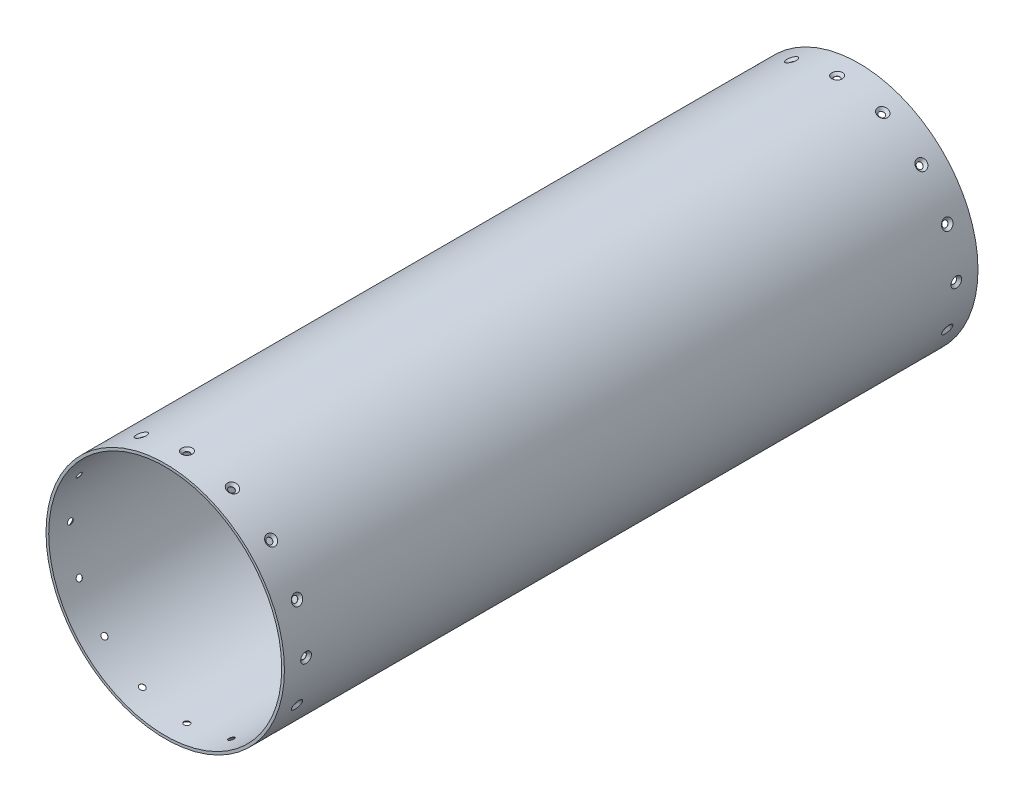
from build123d import *

# Parameters (mm, degrees)
SKETCH1_R                                       = 69.85
SKETCH1_R_2                                     = 68.2625
EXTRUDE1_DEPTH                                  = 406.4
CSK_FOR_M3_FLAT_HEAD_MACHINE_SCREW1_D           = 3.4
CSK_FOR_M3_FLAT_HEAD_MACHINE_SCREW1_CSINK_D     = 6.3
CSK_FOR_M3_FLAT_HEAD_MACHINE_SCREW1_CSINK_ANGLE = 90
CIRPATTERN1_COUNT                               = 16
LPATTERN1_COPY_1_D                              = 3.4
LPATTERN1_COPY_1_CSINK_D                        = 6.3
LPATTERN1_COPY_1_CSINK_ANGLE                    = 90
LPATTERN1_COPY_2_D                              = 3.4
LPATTERN1_COPY_2_CSINK_D                        = 6.3
LPATTERN1_COPY_2_CSINK_ANGLE                    = 90
LPATTERN1_COPY_3_D                              = 3.4
LPATTERN1_COPY_3_CSINK_D                        = 6.3
LPATTERN1_COPY_3_CSINK_ANGLE                    = 90
LPATTERN1_COPY_4_D                              = 3.4
LPATTERN1_COPY_4_CSINK_D                        = 6.3
LPATTERN1_COPY_4_CSINK_ANGLE                    = 90
LPATTERN1_COPY_5_D                              = 3.4
LPATTERN1_COPY_5_CSINK_D                        = 6.3
LPATTERN1_COPY_5_CSINK_ANGLE                    = 90
LPATTERN1_COPY_6_D                              = 3.4
LPATTERN1_COPY_6_CSINK_D                        = 6.3
LPATTERN1_COPY_6_CSINK_ANGLE                    = 90
LPATTERN1_COPY_7_D                              = 3.4
LPATTERN1_COPY_7_CSINK_D                        = 6.3
LPATTERN1_COPY_7_CSINK_ANGLE                    = 90
LPATTERN1_COPY_8_D                              = 3.4
LPATTERN1_COPY_8_CSINK_D                        = 6.3
LPATTERN1_COPY_8_CSINK_ANGLE                    = 90
LPATTERN1_COPY_9_D                              = 3.4
LPATTERN1_COPY_9_CSINK_D                        = 6.3
LPATTERN1_COPY_9_CSINK_ANGLE                    = 90
LPATTERN1_COPY_10_D                             = 3.4
LPATTERN1_COPY_10_CSINK_D                       = 6.3
LPATTERN1_COPY_10_CSINK_ANGLE                   = 90
LPATTERN1_COPY_11_D                             = 3.4
LPATTERN1_COPY_11_CSINK_D                       = 6.3
LPATTERN1_COPY_11_CSINK_ANGLE                   = 90
LPATTERN1_COPY_12_D                             = 3.4
LPATTERN1_COPY_12_CSINK_D                       = 6.3
LPATTERN1_COPY_12_CSINK_ANGLE                   = 90
LPATTERN1_COPY_13_D                             = 3.4
LPATTERN1_COPY_13_CSINK_D                       = 6.3
LPATTERN1_COPY_13_CSINK_ANGLE                   = 90
LPATTERN1_COPY_14_D                             = 3.4
LPATTERN1_COPY_14_CSINK_D                       = 6.3
LPATTERN1_COPY_14_CSINK_ANGLE                   = 90
LPATTERN1_COPY_15_D                             = 3.4
LPATTERN1_COPY_15_CSINK_D                       = 6.3
LPATTERN1_COPY_15_CSINK_ANGLE                   = 90
LPATTERN1_COPY_16_D                             = 3.4
LPATTERN1_COPY_16_CSINK_D                       = 6.3
LPATTERN1_COPY_16_CSINK_ANGLE                   = 90
F_10_CLEARANCE_HOLE4_D                          = 5.1054
F_10_CLEARANCE_HOLE4_DEPTH                      = 12.7
F_10_CLEARANCE_HOLE4_TIP                        = 1.533816902


with BuildPart() as part:
    # Sketch1 → Extrude1 (new body)
    with BuildSketch(Plane.XY):
        Circle(SKETCH1_R)
        Circle(SKETCH1_R_2, mode=Mode.SUBTRACT)
    extrude(amount=EXTRUDE1_DEPTH)

    # CSK for M3 Flat Head Machine Screw1 (through all)
    with Locations(Plane(origin=(0, -69.85, 12.7), x_dir=(1, 0, 0), z_dir=(0, -1, 0))):
        with Locations((0, 0)):
            csk_for_m3_flat_head_machine_screw1 = CounterSinkHole(CSK_FOR_M3_FLAT_HEAD_MACHINE_SCREW1_D / 2, CSK_FOR_M3_FLAT_HEAD_MACHINE_SCREW1_CSINK_D / 2, counter_sink_angle=CSK_FOR_M3_FLAT_HEAD_MACHINE_SCREW1_CSINK_ANGLE)

    # CirPattern1: CSK for M3 Flat Head Machine Screw1 ×16 about axis
    cirpattern1_axis = Axis((0, 0, 406.4), (0, 0, -1))
    for i in range(1, CIRPATTERN1_COUNT):
        add(csk_for_m3_flat_head_machine_screw1.rotate(cirpattern1_axis, i * 360 / CIRPATTERN1_COUNT), mode=Mode.SUBTRACT)

    # LPattern1 copy 1 (through all)
    with Locations(Plane(origin=(-26.730437751, -64.532985346, 393.7), x_dir=(0.9238795325112867, -0.3826834323650898, 0), z_dir=(-0.3826834323650898, -0.9238795325112867, 0))):
        with Locations((0, 0)):
            CounterSinkHole(LPATTERN1_COPY_1_D / 2, LPATTERN1_COPY_1_CSINK_D / 2, counter_sink_angle=LPATTERN1_COPY_1_CSINK_ANGLE)

    # LPattern1 copy 2 (through all)
    with Locations(Plane(origin=(-49.391408666, -49.391408666, 393.7), x_dir=(0.7071067811865476, -0.7071067811865475, 0), z_dir=(-0.7071067811865475, -0.7071067811865476, 0))):
        with Locations((0, 0)):
            CounterSinkHole(LPATTERN1_COPY_2_D / 2, LPATTERN1_COPY_2_CSINK_D / 2, counter_sink_angle=LPATTERN1_COPY_2_CSINK_ANGLE)

    # LPattern1 copy 3 (through all)
    with Locations(Plane(origin=(-64.532985346, -26.730437751, 393.7), x_dir=(0.38268343236508984, -0.9238795325112867, 0), z_dir=(-0.9238795325112867, -0.38268343236508984, 0))):
        with Locations((0, 0)):
            CounterSinkHole(LPATTERN1_COPY_3_D / 2, LPATTERN1_COPY_3_CSINK_D / 2, counter_sink_angle=LPATTERN1_COPY_3_CSINK_ANGLE)

    # LPattern1 copy 4 (through all)
    with Locations(Plane(origin=(-69.85, 0, 393.7), x_dir=(0, -1, 0), z_dir=(-1, 0, 0))):
        with Locations((0, 0)):
            CounterSinkHole(LPATTERN1_COPY_4_D / 2, LPATTERN1_COPY_4_CSINK_D / 2, counter_sink_angle=LPATTERN1_COPY_4_CSINK_ANGLE)

    # LPattern1 copy 5 (through all)
    with Locations(Plane(origin=(-64.532985346, 26.730437751, 393.7), x_dir=(-0.3826834323650897, -0.9238795325112867, 0), z_dir=(-0.9238795325112867, 0.3826834323650897, 0))):
        with Locations((0, 0)):
            CounterSinkHole(LPATTERN1_COPY_5_D / 2, LPATTERN1_COPY_5_CSINK_D / 2, counter_sink_angle=LPATTERN1_COPY_5_CSINK_ANGLE)

    # LPattern1 copy 6 (through all)
    with Locations(Plane(origin=(-49.391408666, 49.391408666, 393.7), x_dir=(-0.7071067811865475, -0.7071067811865476, 0), z_dir=(-0.7071067811865476, 0.7071067811865475, 0))):
        with Locations((0, 0)):
            CounterSinkHole(LPATTERN1_COPY_6_D / 2, LPATTERN1_COPY_6_CSINK_D / 2, counter_sink_angle=LPATTERN1_COPY_6_CSINK_ANGLE)

    # LPattern1 copy 7 (through all)
    with Locations(Plane(origin=(-26.730437751, 64.532985346, 393.7), x_dir=(-0.9238795325112867, -0.3826834323650899, 0), z_dir=(-0.3826834323650899, 0.9238795325112867, 0))):
        with Locations((0, 0)):
            CounterSinkHole(LPATTERN1_COPY_7_D / 2, LPATTERN1_COPY_7_CSINK_D / 2, counter_sink_angle=LPATTERN1_COPY_7_CSINK_ANGLE)

    # LPattern1 copy 8 (through all)
    with Locations(Plane(origin=(0, 69.85, 393.7), x_dir=(-1, 0, 0), z_dir=(0, 1, 0))):
        with Locations((0, 0)):
            CounterSinkHole(LPATTERN1_COPY_8_D / 2, LPATTERN1_COPY_8_CSINK_D / 2, counter_sink_angle=LPATTERN1_COPY_8_CSINK_ANGLE)

    # LPattern1 copy 9 (through all)
    with Locations(Plane(origin=(26.730437751, 64.532985346, 393.7), x_dir=(-0.9238795325112868, 0.38268343236508967, 0), z_dir=(0.38268343236508967, 0.9238795325112868, 0))):
        with Locations((0, 0)):
            CounterSinkHole(LPATTERN1_COPY_9_D / 2, LPATTERN1_COPY_9_CSINK_D / 2, counter_sink_angle=LPATTERN1_COPY_9_CSINK_ANGLE)

    # LPattern1 copy 10 (through all)
    with Locations(Plane(origin=(49.391408666, 49.391408666, 393.7), x_dir=(-0.7071067811865477, 0.7071067811865475, 0), z_dir=(0.7071067811865475, 0.7071067811865477, 0))):
        with Locations((0, 0)):
            CounterSinkHole(LPATTERN1_COPY_10_D / 2, LPATTERN1_COPY_10_CSINK_D / 2, counter_sink_angle=LPATTERN1_COPY_10_CSINK_ANGLE)

    # LPattern1 copy 11 (through all)
    with Locations(Plane(origin=(64.532985346, 26.730437751, 393.7), x_dir=(-0.3826834323650895, 0.9238795325112868, 0), z_dir=(0.9238795325112868, 0.3826834323650895, 0))):
        with Locations((0, 0)):
            CounterSinkHole(LPATTERN1_COPY_11_D / 2, LPATTERN1_COPY_11_CSINK_D / 2, counter_sink_angle=LPATTERN1_COPY_11_CSINK_ANGLE)

    # LPattern1 copy 12 (through all)
    with Locations(Plane(origin=(69.85, 0, 393.7), x_dir=(0, 1, 0), z_dir=(1, 0, 0))):
        with Locations((0, 0)):
            CounterSinkHole(LPATTERN1_COPY_12_D / 2, LPATTERN1_COPY_12_CSINK_D / 2, counter_sink_angle=LPATTERN1_COPY_12_CSINK_ANGLE)

    # LPattern1 copy 13 (through all)
    with Locations(Plane(origin=(64.532985346, -26.730437751, 393.7), x_dir=(0.38268343236509, 0.9238795325112866, 0), z_dir=(0.9238795325112866, -0.38268343236509, 0))):
        with Locations((0, 0)):
            CounterSinkHole(LPATTERN1_COPY_13_D / 2, LPATTERN1_COPY_13_CSINK_D / 2, counter_sink_angle=LPATTERN1_COPY_13_CSINK_ANGLE)

    # LPattern1 copy 14 (through all)
    with Locations(Plane(origin=(49.391408666, -49.391408666, 393.7), x_dir=(0.7071067811865474, 0.7071067811865477, 0), z_dir=(0.7071067811865477, -0.7071067811865474, 0))):
        with Locations((0, 0)):
            CounterSinkHole(LPATTERN1_COPY_14_D / 2, LPATTERN1_COPY_14_CSINK_D / 2, counter_sink_angle=LPATTERN1_COPY_14_CSINK_ANGLE)

    # LPattern1 copy 15 (through all)
    with Locations(Plane(origin=(26.730437751, -64.532985346, 393.7), x_dir=(0.9238795325112868, 0.38268343236508956, 0), z_dir=(0.38268343236508956, -0.9238795325112868, 0))):
        with Locations((0, 0)):
            CounterSinkHole(LPATTERN1_COPY_15_D / 2, LPATTERN1_COPY_15_CSINK_D / 2, counter_sink_angle=LPATTERN1_COPY_15_CSINK_ANGLE)

    # LPattern1 copy 16 (through all)
    with Locations(Plane(origin=(0, -69.85, 393.7), x_dir=(1, 0, 0), z_dir=(0, -1, 0))):
        with Locations((0, 0)):
            CounterSinkHole(LPATTERN1_COPY_16_D / 2, LPATTERN1_COPY_16_CSINK_D / 2, counter_sink_angle=LPATTERN1_COPY_16_CSINK_ANGLE)

    # #10 Clearance Hole4
    with Locations(Plane(origin=(13.627058993, -68.507851836, 12.7), x_dir=(0.9807852804032304, 0.19509032201612864, 0), z_dir=(0.1950903220161286, -0.9807852804032303, 0))):
        with Locations((0, 0)):
            Hole(F_10_CLEARANCE_HOLE4_D / 2, depth=F_10_CLEARANCE_HOLE4_DEPTH)
            with Locations((0, 0, -(F_10_CLEARANCE_HOLE4_DEPTH + F_10_CLEARANCE_HOLE4_TIP / 2))):  # 118° drill point
                Cone(0, F_10_CLEARANCE_HOLE4_D / 2, F_10_CLEARANCE_HOLE4_TIP, mode=Mode.SUBTRACT)


solid = part.part
